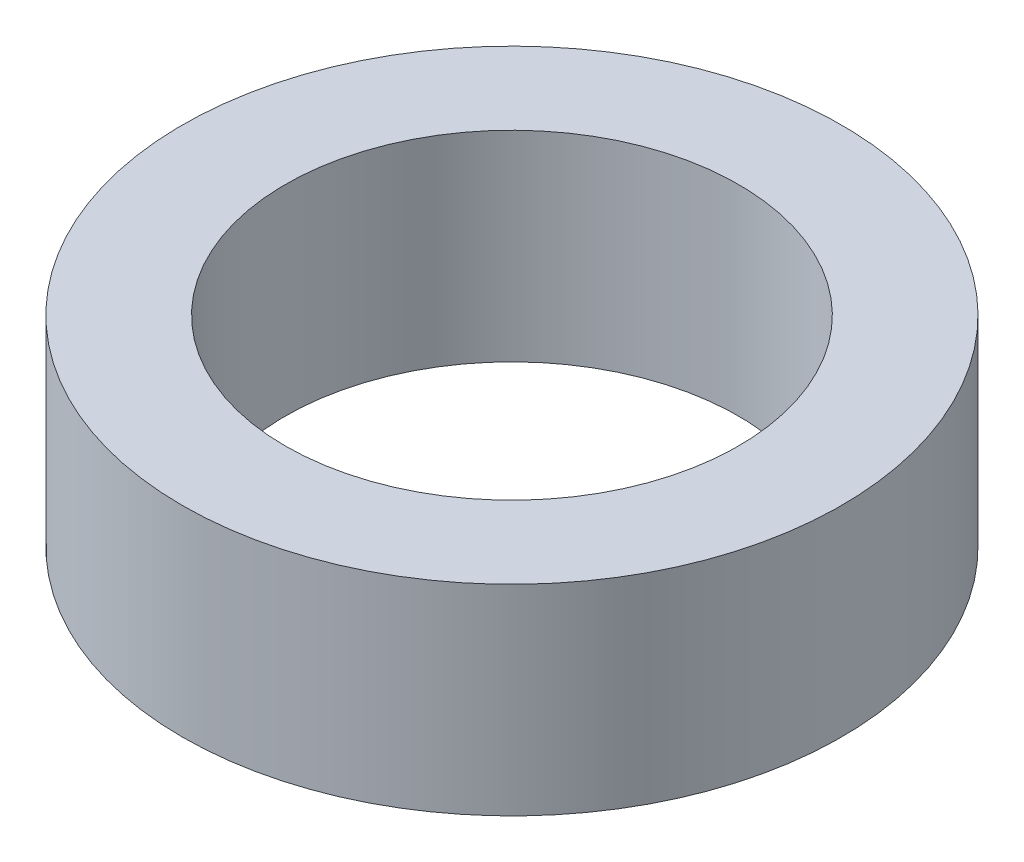
from build123d import *

# Parameters (mm, degrees)
SKETCH1_R           = 9.2
SKETCH1_R_2         = 6.325
BOSS_EXTRUDE1_DEPTH = 5.6


with BuildPart() as part:
    # Sketch1 → Boss-Extrude1 (new body)
    with BuildSketch(Plane(origin=(0, 0, 0), x_dir=(1, 0, 0), z_dir=(0, 1, 0))):
        Circle(SKETCH1_R)
        Circle(SKETCH1_R_2, mode=Mode.SUBTRACT)
    extrude(amount=BOSS_EXTRUDE1_DEPTH)


solid = part.part
